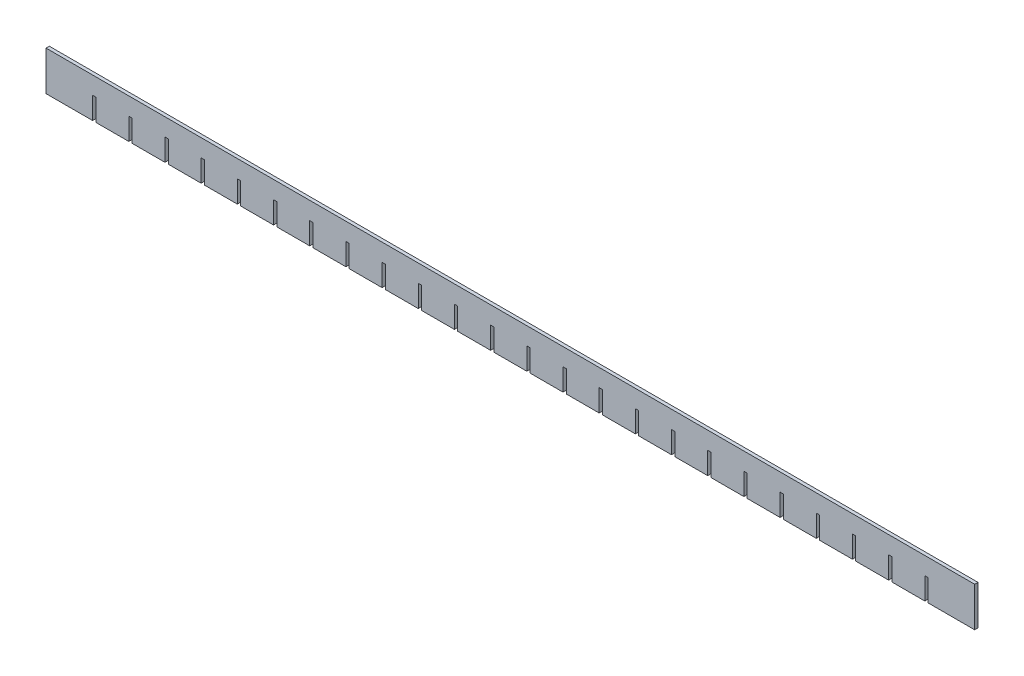
from build123d import *

# Parameters (mm, degrees)
SKETCH1_W           = 847
SKETCH1_H           = 36
BOSS_EXTRUDE1_DEPTH = 3
SKETCH2_W           = 3
SKETCH2_H           = 20
CUT_EXTRUDE1_DEPTH  = 424.892969982
LPATTERN1_COUNT     = 24
LPATTERN1_PITCH     = 33


with BuildPart() as part:
    # Sketch1 → Boss-Extrude1 (new body)
    with BuildSketch(Plane.XY):
        Rectangle(SKETCH1_W, SKETCH1_H)
    extrude(amount=BOSS_EXTRUDE1_DEPTH)

    # Sketch2 → Cut-Extrude1 (cut, through all)
    with BuildSketch(Plane.XY.offset(3)):
        with Locations((-379.5, -8)):
            Rectangle(SKETCH2_W, SKETCH2_H)
    cut_extrude1 = extrude(amount=-CUT_EXTRUDE1_DEPTH, mode=Mode.SUBTRACT)

    # LPattern1: Cut-Extrude1 ×24
    with Locations(*[(i * LPATTERN1_PITCH, 0, 0) for i in range(1, LPATTERN1_COUNT)]):
        add(cut_extrude1, mode=Mode.SUBTRACT)


solid = part.part
